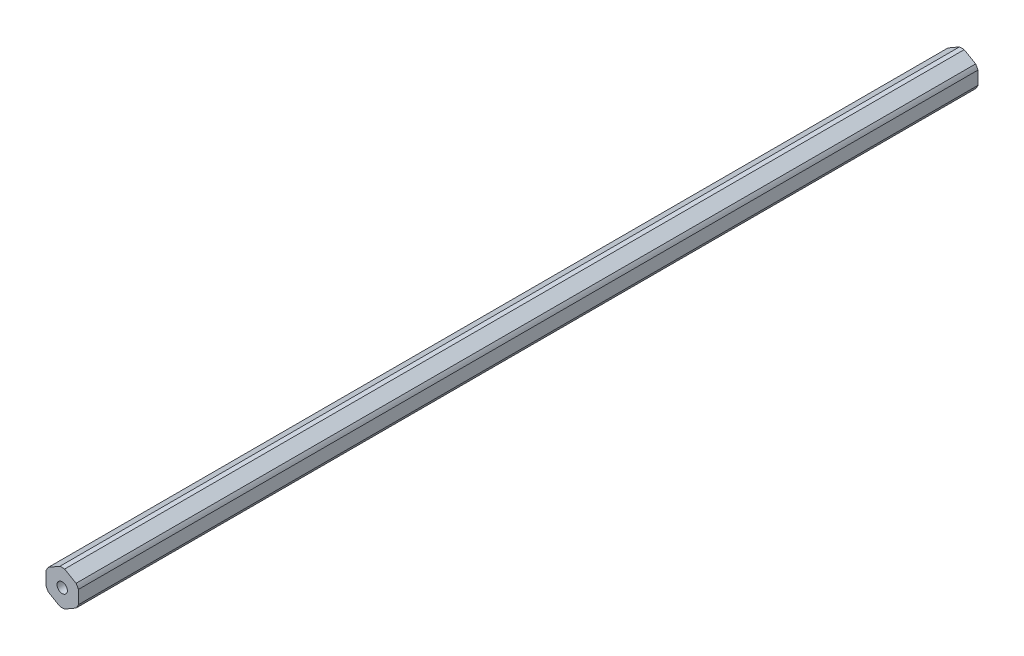
from build123d import *

# Parameters (mm, degrees)
BOSS_EXTRUDE1_DEPTH                  = 176.2125
F_10_32_TAPPED_HOLE1_D               = 4.0386
F_10_32_TAPPED_HOLE1_DEPTH           = 16.34744
F_10_32_TAPPED_HOLE1_TIP             = 1.213317848
F_10_32_TAPPED_HOLE1_ON_FACE_2_D     = 4.0386
F_10_32_TAPPED_HOLE1_ON_FACE_2_DEPTH = 16.34744
F_10_32_TAPPED_HOLE1_ON_FACE_2_TIP   = 1.213317848


with BuildPart() as part:
    # Sketch1 → Boss-Extrude1 (new, symmetric)
    with BuildSketch(Plane.XY):
        with BuildLine():
            ThreePointArc((0.93173274, 6.79441227), (0, 6.858), (-0.93173274, 6.79441227))
            Line((-0.93173274, 6.79441227), (-5.41826726, 4.204110358))
            ThreePointArc((-5.41826726, 4.204110358), (-5.939202219, 3.429), (-6.35, 2.590301913))
            Line((-6.35, 2.590301913), (-6.35, -2.590301913))
            ThreePointArc((-6.35, -2.590301913), (-5.939202219, -3.429), (-5.41826726, -4.204110358))
            Line((-5.41826726, -4.204110358), (-0.93173274, -6.79441227))
            ThreePointArc((-0.93173274, -6.79441227), (0, -6.858), (0.93173274, -6.79441227))
            Line((0.93173274, -6.79441227), (5.41826726, -4.204110358))
            ThreePointArc((5.41826726, -4.204110358), (5.939202219, -3.429), (6.35, -2.590301913))
            Line((6.35, -2.590301913), (6.35, 2.590301913))
            ThreePointArc((6.35, 2.590301913), (5.939202219, 3.429), (5.41826726, 4.204110358))
            Line((5.41826726, 4.204110358), (0.93173274, 6.79441227))
        make_face()
    extrude(amount=BOSS_EXTRUDE1_DEPTH, both=True)

    # #10-32 Tapped Hole1
    with Locations(Plane.XY.offset(176.2125)):
        with Locations((0, 0)):
            Hole(F_10_32_TAPPED_HOLE1_D / 2, depth=F_10_32_TAPPED_HOLE1_DEPTH)
            with Locations((0, 0, -(F_10_32_TAPPED_HOLE1_DEPTH + F_10_32_TAPPED_HOLE1_TIP / 2))):  # 118° drill point
                Cone(0, F_10_32_TAPPED_HOLE1_D / 2, F_10_32_TAPPED_HOLE1_TIP, mode=Mode.SUBTRACT)

    # #10-32 Tapped Hole1 on face 2
    with Locations(Plane(origin=(0, 0, -176.2125), x_dir=(-1, 0, 0), z_dir=(0, 0, -1))):
        with Locations((0, 0)):
            Hole(F_10_32_TAPPED_HOLE1_ON_FACE_2_D / 2, depth=F_10_32_TAPPED_HOLE1_ON_FACE_2_DEPTH)
            with Locations((0, 0, -(F_10_32_TAPPED_HOLE1_ON_FACE_2_DEPTH + F_10_32_TAPPED_HOLE1_ON_FACE_2_TIP / 2))):  # 118° drill point
                Cone(0, F_10_32_TAPPED_HOLE1_ON_FACE_2_D / 2, F_10_32_TAPPED_HOLE1_ON_FACE_2_TIP, mode=Mode.SUBTRACT)


solid = part.part
